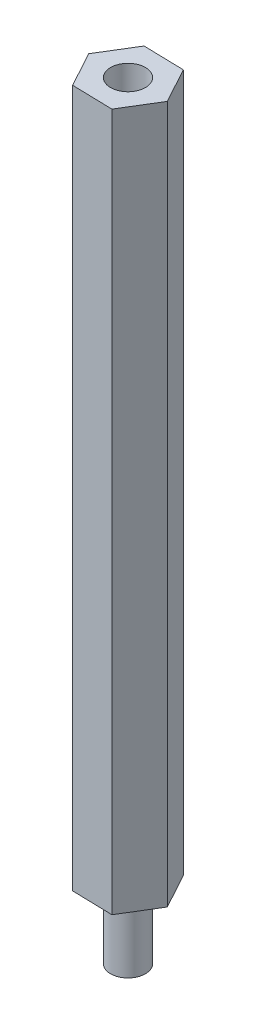
from build123d import *

# Parameters (mm, degrees)
EXTRUDE_1_DEPTH     = 60
SKETCH_2_R          = 1.5
CUT_EXTRUDE_1_DEPTH = 8
SKETCH_3_R          = 1.5
EXTRUDE_2_DEPTH     = 6


with BuildPart() as part:
    # 스케치1 → 보스-돌출1 (new body)
    with BuildSketch(Plane(origin=(0, 0, 0), x_dir=(1, 0, 0), z_dir=(0, 1, 0))):
        Polygon((1.655656385, -3.04282795), (3.462994497, -0.087573486), (1.807338112, 2.955254464), (-1.655656385, 3.04282795), (-3.462994497, 0.087573486), (-1.807338112, -2.955254464), align=None)
    extrude(amount=EXTRUDE_1_DEPTH)

    # 스케치2 → 컷-돌출1 (cut)
    with BuildSketch(Plane(origin=(0, 60, 0), x_dir=(1, 0, 0), z_dir=(0, 1, 0))):
        Circle(SKETCH_2_R)
    extrude(amount=-CUT_EXTRUDE_1_DEPTH, mode=Mode.SUBTRACT)

    # 스케치3 → 보스-돌출2 (add)
    with BuildSketch(Plane.XZ):
        Circle(SKETCH_3_R)
    extrude(amount=EXTRUDE_2_DEPTH)


solid = part.part
